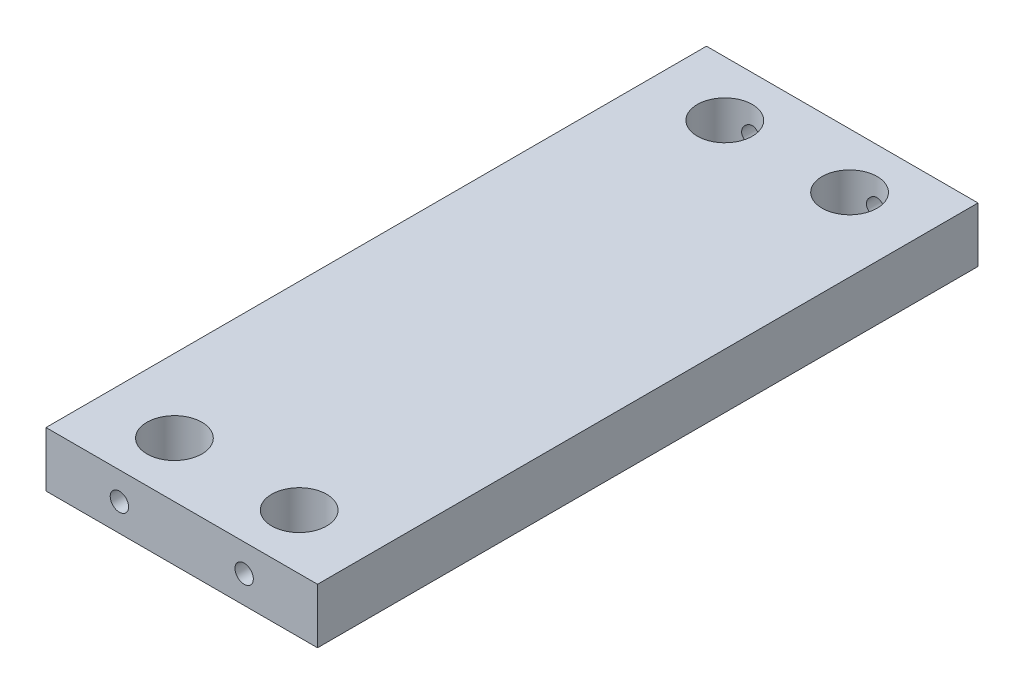
from build123d import *

# Parameters (mm, degrees)
SKETCH1_W           = 93.98
SKETCH1_H           = 228.6
BOSS_EXTRUDE1_DEPTH = 19.05


with BuildPart() as part:
    # Sketch1 → Boss-Extrude1 (new body)
    with BuildSketch(Plane(origin=(0, 0, 0), x_dir=(1, 0, 0), z_dir=(0, 1, 0))):
        Rectangle(SKETCH1_W, SKETCH1_H)
    extrude(amount=BOSS_EXTRUDE1_DEPTH)

    # Sketch2 → 3/4 (0.75) Diameter Hole1 (revolve, cut)
    with BuildSketch(Plane(origin=(-21.59, 19.05, -95.25), x_dir=(0, 0, 1), z_dir=(1, 0, 0))):
        Polygon((0, 0), (0, 24.773197396), (9.525, 19.05), (9.525, 0), align=None)
    f_3_4_0_75_diameter_hole1 = revolve(axis=Axis((-21.59, 25.4, -95.25), (0, -1, 0)), mode=Mode.SUBTRACT)

    # Mirror1: 3/4 (0.75) Diameter Hole1 across plane
    add(f_3_4_0_75_diameter_hole1.mirror(Plane.XY), mode=Mode.SUBTRACT)

    # Mirror4: 3/4 (0.75) Diameter Hole1 across plane
    add(f_3_4_0_75_diameter_hole1.mirror(Plane(origin=(0, 0, 0), x_dir=(0, 0, 1), z_dir=(1, 0, 0))), mode=Mode.SUBTRACT)

    # Mirror4 copy 1 sketch → Mirror4 copy 1 (revolve, cut)
    with BuildSketch(Plane(origin=(21.59, 19.05, 95.25), x_dir=(0, 0, -1), z_dir=(-1, 0, 0))):
        Polygon((0, 0), (0, 24.773197396), (9.525, 19.05), (9.525, 0), align=None)
    revolve(axis=Axis((21.59, 25.4, 95.25), (0, -1, 0)), mode=Mode.SUBTRACT)

    # Sketch4 → 1/4 (0.25) Diameter Hole1 (revolve, cut)
    with BuildSketch(Plane(origin=(21.59, 9.525, -114.3), x_dir=(0, 1, 0), z_dir=(1, 0, 0))):
        Polygon((0, 0), (0, 20.957732465), (3.175, 19.05), (3.175, 0), align=None)
    f_1_4_0_25_diameter_hole1 = revolve(axis=Axis((21.59, 9.525, -120.65), (0, 0, 1)), mode=Mode.SUBTRACT)

    # Mirror5: 1/4 (0.25) Diameter Hole1 across plane
    add(f_1_4_0_25_diameter_hole1.mirror(Plane.XY), mode=Mode.SUBTRACT)

    # Mirror10 copy 1 sketch → Mirror10 copy 1 (revolve, cut)
    with BuildSketch(Plane(origin=(-21.59, 9.525, 114.3), x_dir=(0, 1, 0), z_dir=(-1, 0, 0))):
        Polygon((0, 0), (0, 20.957732465), (3.175, 19.05), (3.175, 0), align=None)
    revolve(axis=Axis((-21.59, 9.525, 120.65), (0, 0, -1)), mode=Mode.SUBTRACT)

    # Mirror10 copy 2 sketch → Mirror10 copy 2 (revolve, cut)
    with BuildSketch(Plane(origin=(-21.59, 9.525, -114.3), x_dir=(0, 1, 0), z_dir=(-1, 0, 0))):
        Polygon((0, 0), (0, -20.957732465), (3.175, -19.05), (3.175, 0), align=None)
    revolve(axis=Axis((-21.59, 9.525, -120.65), (0, 0, -1)), mode=Mode.SUBTRACT)


solid = part.part
